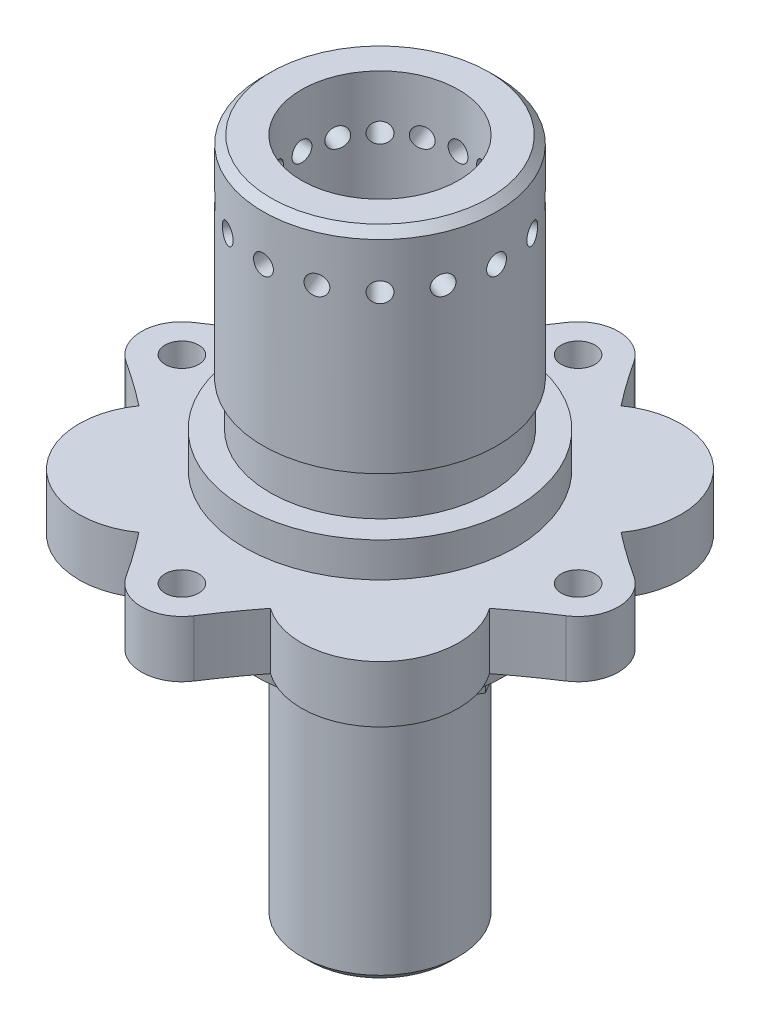
from build123d import *

# Parameters (mm, degrees)
SKETCH5_W                     = 15.875
SKETCH5_H                     = 79.375
DRIVE_PIN_HOLES_D             = 6.8
DRIVE_PIN_HOLES_PATTERN_COUNT = 4
FLANGE_SUPPORT_CUT_REACH      = 103.939
SKETCH8_R                     = 52.5
SKETCH10_R                    = 25.0825
BRAKE_HAT_HEX_DEPTH           = 4.7625
M10_CLEARANCE_HOLE1_D         = 11
SKETCH14_R                    = 2
PIN_HOLES_DEPTH               = 98.561648779
PIN_HOLE_PATTERN_COUNT        = 16


with BuildPart() as part:
    # Sketch1 → Bearing Shaft/Flange Support (revolve)
    with BuildSketch(Plane(origin=(0, 0, 0), x_dir=(0, 0, -1), z_dir=(1, 0, 0))):
        Polygon((0, 0), (-27.254672075, 0), (-25.0825, -12.319), (-25.0825, -17.0815), (-15.875, -17.0815), (-15.875, -65.8749), (-14.2875, -67.4624), (0, -67.4624), align=None)
    revolve(axis=Axis((0, 0, 0), (0, 1, 0)))

    # Sketch2 → Drive Pin Support (revolve)
    with BuildSketch(Plane(origin=(0, 0, 0), x_dir=(0, 0, -1), z_dir=(1, 0, 0))):
        Polygon((0, 0), (-52.5, 0), (-52.5, 11.43), (-27.4096, 11.43), (-27.4096, 18.43), (-22.225, 18.43), (-22.225, 27.305), (-23.61946, 27.305), (-23.61946, 68.2625), (-22.03196, 69.85), (0, 69.85), align=None)
    revolve(axis=Axis((0, 0, 0), (0, 1, 0)))

    # Sketch5 → Center Mass Removal (revolve, cut)
    with BuildSketch(Plane(origin=(0, 0, 0), x_dir=(0, 0, -1), z_dir=(1, 0, 0))):
        with Locations((7.9375, 30.1625)):
            Rectangle(SKETCH5_W, SKETCH5_H)
    revolve(axis=Axis((0, 0, 0), (0, -1, 0)), mode=Mode.SUBTRACT)

    # Drive Pin Holes (through all)
    with Locations(Plane(origin=(0, 0, 0), x_dir=(-1, 0, 0), z_dir=(0, -1, 0))):
        with Locations((0, -40)):
            drive_pin_holes = Hole(DRIVE_PIN_HOLES_D / 2)

    # Drive Pin Holes Pattern: Drive Pin Holes ×4 about axis
    drive_pin_holes_pattern_axis = Axis((0, 0, 0), (0, -1, 0))
    for i in range(1, DRIVE_PIN_HOLES_PATTERN_COUNT):
        add(drive_pin_holes.rotate(drive_pin_holes_pattern_axis, i * 360 / DRIVE_PIN_HOLES_PATTERN_COUNT), mode=Mode.SUBTRACT)

    # Sketch8 → Flange Support Cut (cut, up to next)
    with BuildSketch(Plane.XZ, mode=Mode.PRIVATE) as flange_support_cut_sk1:
        Circle(SKETCH8_R)
        with BuildLine():
            ThreePointArc((-6.851776468, 44.436165629), (0, 48.1625), (6.851776468, 44.436165629))
            ThreePointArc((6.851776468, 44.436165629), (9.964767607, 39.850591878), (13.274865482, 35.405206349))
            ThreePointArc((13.274865482, 35.405206349), (33.675960454, 33.675960454), (35.405206349, 13.274865482))
            ThreePointArc((35.405206349, 13.274865482), (39.850591878, 9.964767607), (44.436165629, 6.851776468))
            ThreePointArc((44.436165629, 6.851776468), (48.1625, 0), (44.436165629, -6.851776468))
            ThreePointArc((44.436165629, -6.851776468), (39.850591878, -9.964767607), (35.405206349, -13.274865482))
            ThreePointArc((35.405206349, -13.274865482), (33.675960454, -33.675960454), (13.274865482, -35.405206349))
            ThreePointArc((13.274865482, -35.405206349), (9.964767607, -39.850591878), (6.851776468, -44.436165629))
            ThreePointArc((6.851776468, -44.436165629), (0, -48.1625), (-6.851776468, -44.436165629))
            ThreePointArc((-6.851776468, -44.436165629), (-9.964767607, -39.850591878), (-13.274865482, -35.405206349))
            ThreePointArc((-13.274865482, -35.405206349), (-33.675960454, -33.675960454), (-35.405206349, -13.274865482))
            ThreePointArc((-35.405206349, -13.274865482), (-39.850591878, -9.964767607), (-44.436165629, -6.851776468))
            ThreePointArc((-44.436165629, -6.851776468), (-48.1625, 0), (-44.436165629, 6.851776468))
            ThreePointArc((-44.436165629, 6.851776468), (-39.850591878, 9.964767607), (-35.405206349, 13.274865482))
            ThreePointArc((-35.405206349, 13.274865482), (-33.675960454, 33.675960454), (-13.274865482, 35.405206349))
            ThreePointArc((-13.274865482, 35.405206349), (-9.964767607, 39.850591878), (-6.851776468, 44.436165629))
        make_face(mode=Mode.SUBTRACT)
    flange_support_cut_tool1 = extrude(flange_support_cut_sk1.sketch, amount=-FLANGE_SUPPORT_CUT_REACH, mode=Mode.PRIVATE) & part.part
    add(flange_support_cut_tool1.solids().sort_by_distance((-51.015076, 0, 0))[0], mode=Mode.SUBTRACT)

    # Sketch10 → Brake Hat Hex (cut)
    with BuildSketch(Plane.XZ.offset(17.0815)):
        Circle(SKETCH10_R)
        Polygon((10.631905207, -18.415), (21.263810414, 0), (10.631905207, 18.415), (-10.631905207, 18.415), (-21.263810414, 0), (-10.631905207, -18.415), align=None, mode=Mode.SUBTRACT)
    extrude(amount=-BRAKE_HAT_HEX_DEPTH, mode=Mode.SUBTRACT)

    # M10 Clearance Hole1 (through all)
    with Locations(Plane(origin=(0, -67.4624, 0), x_dir=(-1, 0, 0), z_dir=(0, -1, 0))):
        with Locations((0, 0)):
            Hole(M10_CLEARANCE_HOLE1_D / 2)

    # Sketch14 → Pin Holes (cut, through all)
    with BuildSketch(Plane(origin=(0, 0, 0), x_dir=(0, 0, -1), z_dir=(1, 0, 0))):
        with Locations((0, 59.05)):
            Circle(SKETCH14_R)
    pin_holes = extrude(amount=-PIN_HOLES_DEPTH, mode=Mode.SUBTRACT)

    # Pin Hole Pattern: Pin Holes ×16 about axis
    pin_hole_pattern_axis = Axis((0, 0, 0), (0, -1, 0))
    for i in range(1, PIN_HOLE_PATTERN_COUNT):
        add(pin_holes.rotate(pin_hole_pattern_axis, i * 360 / PIN_HOLE_PATTERN_COUNT), mode=Mode.SUBTRACT)


solid = part.part
